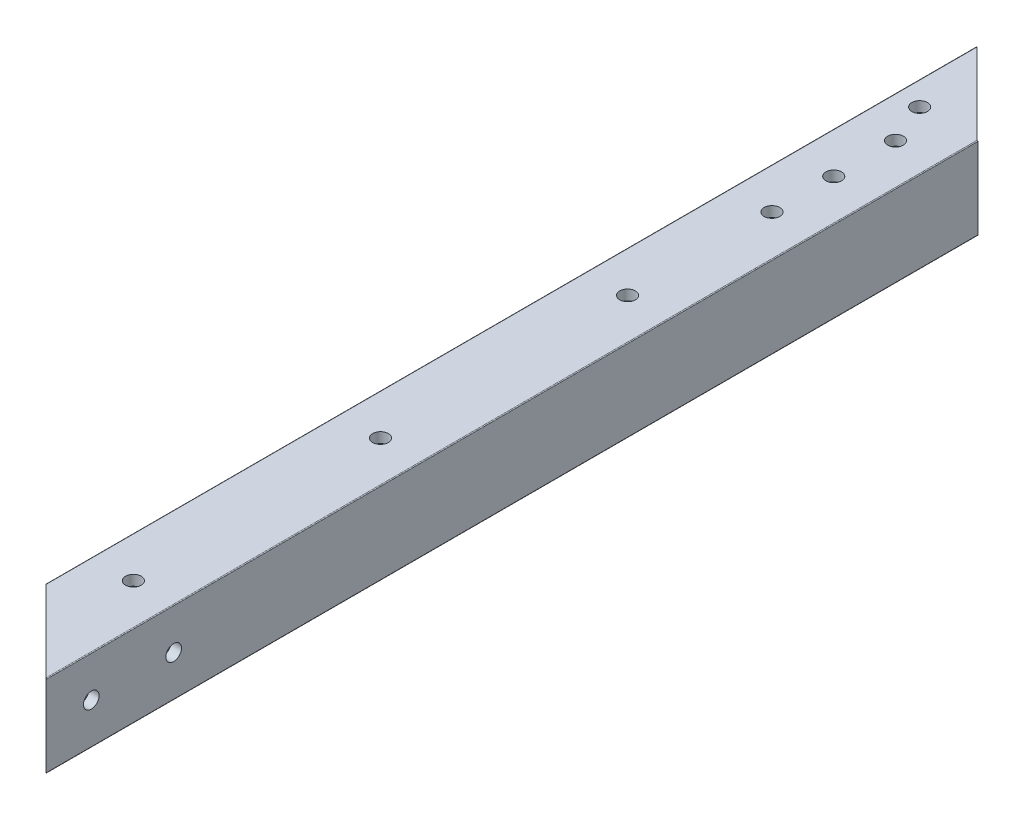
from build123d import *

# Parameters (mm, degrees)
CUT_EXTRUDE1_START = 1516.38
CUT_EXTRUDE1_DEPTH = 312.42
CUT_EXTRUDE2_REACH = 1831.153
CUT_EXTRUDE3_REACH = 1831.153
SKETCH4_R          = 2.413
CUT_EXTRUDE4_DEPTH = 1830.152743759
SKETCH5_R          = 2.413
CUT_EXTRUDE5_DEPTH = 1830.152743759
CUT_EXTRUDE7_REACH = 1831.153
SKETCH8_R          = 2.413


with BuildPart() as part:
    # Cut-Extrude1: read off the stored shape, not the designer's step
    # Cut-Extrude1 outline → Cut-Extrude1 (new body)
    with BuildSketch(Plane.XY.offset(CUT_EXTRUDE1_START)):
        with BuildLine():
            Line((0, 25.146), (0, 0.254))
            ThreePointArc((0, 0.254), (0.074394878, 0.074394878), (0.254, 0))
            Line((0.254, 0), (25.146, 0))
            ThreePointArc((25.146, 0), (25.325605122, 0.074394878), (25.4, 0.254))
            Line((25.4, 0.254), (25.4, 25.146))
            ThreePointArc((25.4, 25.146), (25.325605122, 25.325605122), (25.146, 25.4))
            Line((25.146, 25.4), (0.254, 25.4))
            ThreePointArc((0.254, 25.4), (0.074394878, 25.325605122), (0, 25.146))
        make_face()
        with BuildLine():
            ThreePointArc((4.7625, 3.175), (3.639967985, 3.639967985), (3.175, 4.7625))
            Line((3.175, 4.7625), (3.175, 20.6375))
            ThreePointArc((3.175, 20.6375), (3.639967985, 21.760032015), (4.7625, 22.225))
            Line((4.7625, 22.225), (20.6375, 22.225))
            ThreePointArc((20.6375, 22.225), (21.760032015, 21.760032015), (22.225, 20.6375))
            Line((22.225, 20.6375), (22.225, 4.7625))
            ThreePointArc((22.225, 4.7625), (21.760032015, 3.639967985), (20.6375, 3.175))
            Line((20.6375, 3.175), (4.7625, 3.175))
        make_face(mode=Mode.SUBTRACT)
    extrude(amount=CUT_EXTRUDE1_DEPTH)

    # Cut-Extrude2: up to this face of the body (flat: up to its plane)
    cut_extrude2_end = Plane(part.part.faces().sort_by_distance((12.7, 0, 1672.59))[0])
    # Sketch2 → Cut-Extrude2 (cut, up to the picked face)
    with BuildSketch(Plane(origin=(0, 25.4, 0), x_dir=(1, 0, 0), z_dir=(0, 1, 0)), mode=Mode.PRIVATE) as cut_extrude2_sk1:
        Polygon((43.169380192, -1523.628355708), (25.20886795, -1541.58886795), (-10.712156534, -1505.667843466), (7.248355708, -1487.707331224), align=None)
    cut_extrude2_tool1 = split(extrude(cut_extrude2_sk1.sketch, amount=-CUT_EXTRUDE2_REACH, mode=Mode.PRIVATE), bisect_by=cut_extrude2_end, keep=Keep.BOTH, mode=Mode.PRIVATE)
    add(cut_extrude2_tool1.solids().sort_by(Axis((16.228612, 25.4, 1514.6481), (0, -1, 0)))[0], mode=Mode.SUBTRACT)

    # Cut-Extrude3: up to this face of the body (flat: up to its plane)
    cut_extrude3_end = Plane(part.part.faces().sort_by_distance((12.527724859, 0, 1678.853862429))[0])
    # Sketch3 → Cut-Extrude3 (cut, up to the picked face)
    with BuildSketch(Plane(origin=(0, 25.4, 0), x_dir=(1, 0, 0), z_dir=(0, 1, 0)), mode=Mode.PRIVATE) as cut_extrude3_sk1:
        Polygon((34.192766306, -1837.592766306), (16.232254064, -1855.553278548), (-19.688770421, -1819.632254064), (-1.728258178, -1801.671741822), align=None)
    cut_extrude3_tool1 = split(extrude(cut_extrude3_sk1.sketch, amount=-CUT_EXTRUDE3_REACH, mode=Mode.PRIVATE), bisect_by=cut_extrude3_end, keep=Keep.BOTH, mode=Mode.PRIVATE)
    add(cut_extrude3_tool1.solids().sort_by(Axis((7.251998, 25.4, 1828.61251), (0, -1, 0)))[0], mode=Mode.SUBTRACT)

    # Sketch4 → Cut-Extrude4 (cut, through all)
    with BuildSketch(Plane(origin=(0, 25.4, 0), x_dir=(1, 0, 0), z_dir=(0, 1, 0))):
        with Locations(Location((12.7, -1789.159231637, 0), (0, 0, 270))):
            Circle(SKETCH4_R)
        with Locations(Location((12.7, -1712.959231637, 0), (0, 0, 270))):
            Circle(SKETCH4_R)
        with Locations(Location((12.7, -1636.759231637, 0), (0, 0, 270))):
            Circle(SKETCH4_R)
    extrude(amount=-CUT_EXTRUDE4_DEPTH, mode=Mode.SUBTRACT)

    # Sketch5 → Cut-Extrude5 (cut, through all)
    with BuildSketch(Plane.XZ):
        with Locations(Location((7.439487758, 1541.431804126, 0), (0, 0, 270))):
            Circle(SKETCH5_R)
        with Locations(Location((12.7, 1554.131804126, 0), (0, 0, 270))):
            Circle(SKETCH5_R)
        with Locations(Location((12.7, 1573.181804126, 0), (0, 0, 270))):
            Circle(SKETCH5_R)
        with Locations(Location((12.7, 1592.231804126, 0), (0, 0, 270))):
            Circle(SKETCH5_R)
    extrude(amount=-CUT_EXTRUDE5_DEPTH, mode=Mode.SUBTRACT)

    # Sketch8 → Cut-Extrude7 (cut, up to next)
    with BuildSketch(Plane(origin=(25.4, 0, 0), x_dir=(0, 0, -1), z_dir=(1, 0, 0)), mode=Mode.PRIVATE) as cut_extrude7_sk1:
        with Locations((-1814.83, 12.7)):
            Circle(SKETCH8_R)
    cut_extrude7_tool1 = extrude(cut_extrude7_sk1.sketch, amount=-CUT_EXTRUDE7_REACH, mode=Mode.PRIVATE) & part.part
    # Sketch8 → Cut-Extrude7 (cut, up to next)
    with BuildSketch(Plane(origin=(25.4, 0, 0), x_dir=(0, 0, -1), z_dir=(1, 0, 0)), mode=Mode.PRIVATE) as cut_extrude7_sk2:
        with Locations((-1789.43, 12.7)):
            Circle(SKETCH8_R)
    cut_extrude7_tool2 = extrude(cut_extrude7_sk2.sketch, amount=-CUT_EXTRUDE7_REACH, mode=Mode.PRIVATE) & part.part
    add(cut_extrude7_tool1.solids().sort_by_distance((25.4, 12.7, 1814.83))[0], mode=Mode.SUBTRACT)
    add(cut_extrude7_tool2.solids().sort_by_distance((25.4, 12.7, 1789.43))[0], mode=Mode.SUBTRACT)


solid = part.part
